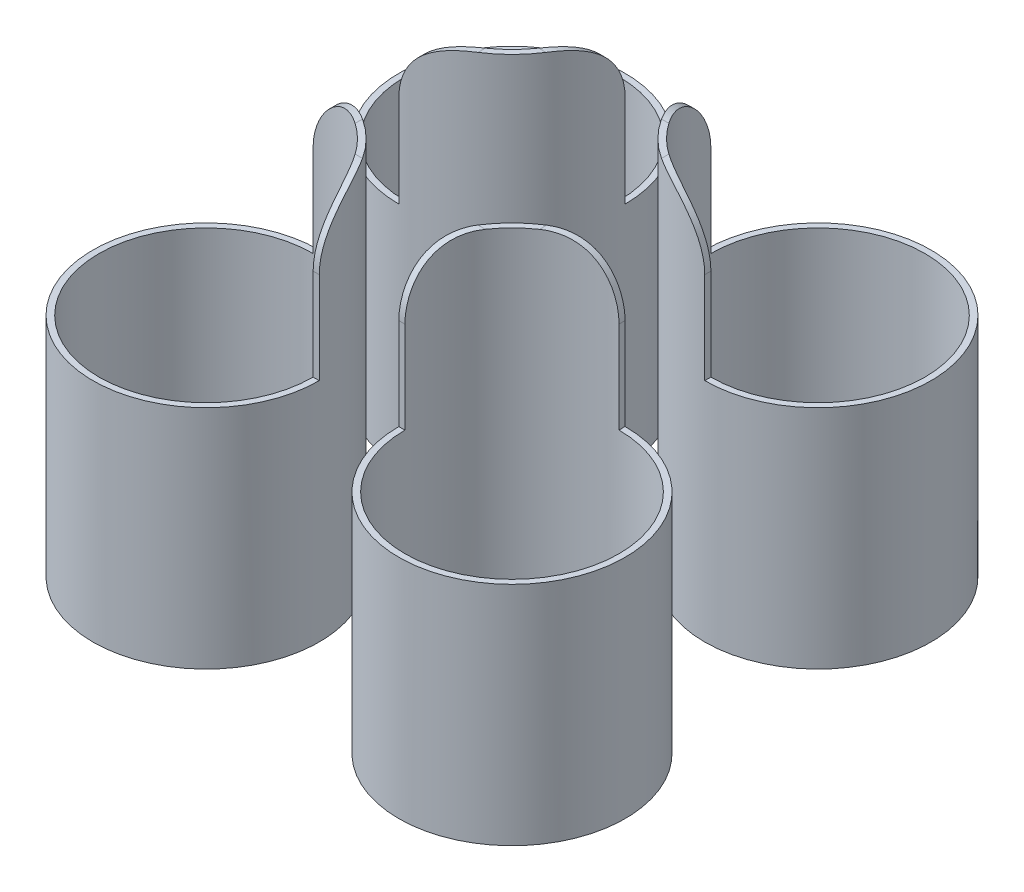
from build123d import *

# Parameters (mm, degrees)
SKETCH1_R             = 18.5
SKETCH1_R_2           = 4.4
BOSS_EXTRUDE1_DEPTH   = 2
BOSS_EXTRUDE1_2_DEPTH = 2
BOSS_EXTRUDE1_3_DEPTH = 2
BOSS_EXTRUDE1_4_DEPTH = 2
SKETCH2_R             = 18.5
SKETCH2_R_2           = 17.5
BOSS_EXTRUDE2_DEPTH   = 35
BOSS_EXTRUDE3_DEPTH   = 25
FILLET1_R             = 10
FILLET2_R             = 10
FILLET3_R             = 10
FILLET4_R             = 10


with BuildPart() as part:
    # Sketch1 → Boss-Extrude1 (new body)
    with BuildSketch(Plane(origin=(0, 0, 0), x_dir=(1, 0, 0), z_dir=(0, 1, 0))):
        with Locations(Location((0, 0, 0), (0, 0, 270))):
            Circle(SKETCH1_R)
        with Locations(Location((-7, -7, 0), (0, 0, 270))):
            Circle(SKETCH1_R_2, mode=Mode.SUBTRACT)
        with Locations(Location((-7, 7, 0), (0, 0, 270))):
            Circle(SKETCH1_R_2, mode=Mode.SUBTRACT)
        with Locations(Location((7, 7, 0), (0, 0, 270))):
            Circle(SKETCH1_R_2, mode=Mode.SUBTRACT)
        with Locations(Location((7, -7, 0), (0, 0, 270))):
            Circle(SKETCH1_R_2, mode=Mode.SUBTRACT)
    extrude(amount=BOSS_EXTRUDE1_DEPTH)



with BuildPart() as body_2:
    # Sketch1 → Boss-Extrude1 2 (new body)
    with BuildSketch(Plane(origin=(0, 0, 0), x_dir=(1, 0, 0), z_dir=(0, 1, 0))):
        with Locations(Location((0, 50, 0), (0, 0, 270))):
            Circle(SKETCH1_R)
        with Locations(Location((-7, 43, 0), (0, 0, 270))):
            Circle(SKETCH1_R_2, mode=Mode.SUBTRACT)
        with Locations(Location((-7, 57, 0), (0, 0, 270))):
            Circle(SKETCH1_R_2, mode=Mode.SUBTRACT)
        with Locations(Location((7, 43, 0), (0, 0, 270))):
            Circle(SKETCH1_R_2, mode=Mode.SUBTRACT)
        with Locations(Location((7, 57, 0), (0, 0, 270))):
            Circle(SKETCH1_R_2, mode=Mode.SUBTRACT)
    extrude(amount=BOSS_EXTRUDE1_2_DEPTH)


with BuildPart() as body_3:
    # Sketch1 → Boss-Extrude1 3 (new body)
    with BuildSketch(Plane(origin=(0, 0, 0), x_dir=(1, 0, 0), z_dir=(0, 1, 0))):
        with Locations(Location((50, 0, 0), (0, 0, 270))):
            Circle(SKETCH1_R)
        with Locations(Location((43, -7, 0), (0, 0, 270))):
            Circle(SKETCH1_R_2, mode=Mode.SUBTRACT)
        with Locations(Location((43, 7, 0), (0, 0, 270))):
            Circle(SKETCH1_R_2, mode=Mode.SUBTRACT)
        with Locations(Location((57, -7, 0), (0, 0, 270))):
            Circle(SKETCH1_R_2, mode=Mode.SUBTRACT)
        with Locations(Location((57, 7, 0), (0, 0, 270))):
            Circle(SKETCH1_R_2, mode=Mode.SUBTRACT)
    extrude(amount=BOSS_EXTRUDE1_3_DEPTH)


with BuildPart() as body_4:
    # Sketch1 → Boss-Extrude1 4 (new body)
    with BuildSketch(Plane(origin=(0, 0, 0), x_dir=(1, 0, 0), z_dir=(0, 1, 0))):
        with Locations(Location((50, 50, 0), (0, 0, 270))):
            Circle(SKETCH1_R)
        with Locations(Location((43, 43, 0), (0, 0, 270))):
            Circle(SKETCH1_R_2, mode=Mode.SUBTRACT)
        with Locations(Location((57, 43, 0), (0, 0, 270))):
            Circle(SKETCH1_R_2, mode=Mode.SUBTRACT)
        with Locations(Location((43, 57, 0), (0, 0, 270))):
            Circle(SKETCH1_R_2, mode=Mode.SUBTRACT)
        with Locations(Location((57, 57, 0), (0, 0, 270))):
            Circle(SKETCH1_R_2, mode=Mode.SUBTRACT)
    extrude(amount=BOSS_EXTRUDE1_4_DEPTH)


with BuildPart() as part_1:
    add(part.part)

    add(body_2.part)  # Boss-Extrude2 merges body 2

    add(body_3.part)  # Boss-Extrude2 merges body 3

    add(body_4.part)  # Boss-Extrude2 merges body 4
    # Sketch2 → Boss-Extrude2 (add)
    # profile 1 of 4: a face of its own
    with BuildSketch(Plane(origin=(0, 2, 0), x_dir=(1, 0, 0), z_dir=(0, 1, 0))):
        with Locations(Location((0, 0, 0), (0, 0, 90))):
            Circle(SKETCH2_R)
        with Locations(Location((0, 0, 0), (0, 0, 90))):
            Circle(SKETCH2_R_2, mode=Mode.SUBTRACT)
    # profile 2 of 4: a face of its own
    with BuildSketch(Plane(origin=(0, 2, 0), x_dir=(1, 0, 0), z_dir=(0, 1, 0))):
        with Locations(Location((50, 0, 0), (0, 0, 90))):
            Circle(SKETCH2_R)
        with Locations(Location((50, 0, 0), (0, 0, 90))):
            Circle(SKETCH2_R_2, mode=Mode.SUBTRACT)
    # profile 3 of 4: a face of its own
    with BuildSketch(Plane(origin=(0, 2, 0), x_dir=(1, 0, 0), z_dir=(0, 1, 0))):
        with Locations(Location((50, 50, 0), (0, 0, 90))):
            Circle(SKETCH2_R)
        with Locations(Location((50, 50, 0), (0, 0, 90))):
            Circle(SKETCH2_R_2, mode=Mode.SUBTRACT)
    # profile 4 of 4: a face of its own
    with BuildSketch(Plane(origin=(0, 2, 0), x_dir=(1, 0, 0), z_dir=(0, 1, 0))):
        with Locations(Location((0, 50, 0), (0, 0, 90))):
            Circle(SKETCH2_R)
        with Locations(Location((0, 50, 0), (0, 0, 90))):
            Circle(SKETCH2_R_2, mode=Mode.SUBTRACT)
    extrude(amount=BOSS_EXTRUDE2_DEPTH)

    # Sketch3 → Boss-Extrude3 (add)
    with BuildSketch(Plane(origin=(0, 37, 0), x_dir=(1, 0, 0), z_dir=(0, 1, 0))):
        with BuildLine():
            ThreePointArc((31.5, 50), (36.918524548, 36.918524548), (50, 31.5))
            Line((50, 31.5), (50, 32.5))
            ThreePointArc((50, 32.5), (37.625631329, 37.625631329), (32.5, 50))
            Line((32.5, 50), (31.5, 50))
        make_face()
        with BuildLine():
            ThreePointArc((0, 31.5), (13.081475452, 36.918524548), (18.5, 50))
            Line((18.5, 50), (17.5, 50))
            ThreePointArc((17.5, 50), (12.374368671, 37.625631329), (0, 32.5))
            Line((0, 32.5), (0, 31.5))
        make_face()
        with BuildLine():
            ThreePointArc((18.5, 0), (13.081475452, 13.081475452), (0, 18.5))
            Line((0, 18.5), (0, 17.5))
            ThreePointArc((0, 17.5), (12.374368671, 12.374368671), (17.5, 0))
            Line((17.5, 0), (18.5, 0))
        make_face()
        with BuildLine():
            Line((50, 17.5), (49.967973628, 18.499972279))
            ThreePointArc((49.967973628, 18.499972279), (36.907206412, 13.070147515), (31.5, 0))
            Line((31.5, 0), (32.5, 0))
            ThreePointArc((32.5, 0), (37.625631329, 12.374368671), (50, 17.5))
        make_face()
    extrude(amount=BOSS_EXTRUDE3_DEPTH)

    # Fillet1
    # the kernel refuses this fillet: 10 mm, written as the material it takes off along each edge
    with BuildSketch(Plane(origin=(50.800271171, 62, 7.487188038), x_dir=(0, -1, 0), z_dir=(-0.032010846851567645, 0, -0.9994875215248291))) as fillet1_piece_1_section:
        with BuildLine():
            CenterArc((FILLET1_R, FILLET1_R), FILLET1_R, 180, 90)
            Line((0, FILLET1_R), (-FILLET1_R * 0.02, FILLET1_R))
            Line((-FILLET1_R * 0.02, FILLET1_R), (-FILLET1_R * 0.02, -FILLET1_R * 0.02))
            Line((-FILLET1_R * 0.02, -FILLET1_R * 0.02), (FILLET1_R, -FILLET1_R * 0.02))
            Line((FILLET1_R, -FILLET1_R * 0.02), (FILLET1_R, 0))
        make_face()
    fillet1_piece_1 = extrude(amount=51.000485006, mode=Mode.PRIVATE)
    fillet1_piece_1 = fillet1_piece_1 & Plane(origin=(50, 59.758154055, 0), x_dir=(-0.001731155259173072, 0, -0.9999985015496117), z_dir=(0, -1, 0)) * Cylinder(18.5, 143, mode=Mode.PRIVATE)
    fillet1_piece_1 = fillet1_piece_1 - Plane(origin=(50, 59.758154055, 0), x_dir=(-1, 0, 0), z_dir=(0, -1, 0)) * Cylinder(17.5, 143, mode=Mode.PRIVATE)
    add(fillet1_piece_1, mode=Mode.SUBTRACT)
    with BuildSketch(Plane(origin=(6.5, 62, 0), x_dir=(0, -1, 0), z_dir=(1, 0, 0))) as fillet1_piece_2_section:
        with BuildLine():
            CenterArc((FILLET1_R, FILLET1_R), FILLET1_R, 180, 90)
            Line((0, FILLET1_R), (-FILLET1_R * 0.02, FILLET1_R))
            Line((-FILLET1_R * 0.02, FILLET1_R), (-FILLET1_R * 0.02, -FILLET1_R * 0.02))
            Line((-FILLET1_R * 0.02, -FILLET1_R * 0.02), (FILLET1_R, -FILLET1_R * 0.02))
            Line((FILLET1_R, -FILLET1_R * 0.02), (FILLET1_R, 0))
        make_face()
    fillet1_piece_2 = extrude(amount=51, mode=Mode.PRIVATE)
    fillet1_piece_2 = fillet1_piece_2 & Plane(origin=(50, 59.763635788, 0), x_dir=(-0.001731155259173072, 0, -0.9999985015496117), z_dir=(0, -1, 0)) * Cylinder(18.5, 142, mode=Mode.PRIVATE)
    fillet1_piece_2 = fillet1_piece_2 - Plane(origin=(50, 59.763635788, 0), x_dir=(-1, 0, 0), z_dir=(0, -1, 0)) * Cylinder(17.5, 142, mode=Mode.PRIVATE)
    add(fillet1_piece_2, mode=Mode.SUBTRACT)

    # Fillet2
    # the kernel refuses this fillet: 10 mm, written as the material it takes off along each edge
    with BuildSketch(Plane(origin=(57.5, 62, -50), x_dir=(0, -1, 0), z_dir=(-1, 0, 0))) as fillet2_piece_1_section:
        with BuildLine():
            CenterArc((FILLET2_R, FILLET2_R), FILLET2_R, 180, 90)
            Line((0, FILLET2_R), (-FILLET2_R * 0.02, FILLET2_R))
            Line((-FILLET2_R * 0.02, FILLET2_R), (-FILLET2_R * 0.02, -FILLET2_R * 0.02))
            Line((-FILLET2_R * 0.02, -FILLET2_R * 0.02), (FILLET2_R, -FILLET2_R * 0.02))
            Line((FILLET2_R, -FILLET2_R * 0.02), (FILLET2_R, 0))
        make_face()
    fillet2_piece_1 = extrude(amount=51, mode=Mode.PRIVATE)
    fillet2_piece_1 = fillet2_piece_1 & Plane(origin=(50, 59.763632396, -50), x_dir=(-1, 0, 0), z_dir=(0, -1, 0)) * Cylinder(18.5, 142, mode=Mode.PRIVATE)
    fillet2_piece_1 = fillet2_piece_1 - Plane(origin=(50, 59.763632396, -50), x_dir=(0, 0, 1), z_dir=(0, -1, 0)) * Cylinder(17.5, 142, mode=Mode.PRIVATE)
    add(fillet2_piece_1, mode=Mode.SUBTRACT)
    with BuildSketch(Plane(origin=(50, 62, -6.5), x_dir=(0, -1, 0), z_dir=(0, 0, -1))) as fillet2_piece_2_section:
        with BuildLine():
            CenterArc((FILLET2_R, FILLET2_R), FILLET2_R, 180, 90)
            Line((0, FILLET2_R), (-FILLET2_R * 0.02, FILLET2_R))
            Line((-FILLET2_R * 0.02, FILLET2_R), (-FILLET2_R * 0.02, -FILLET2_R * 0.02))
            Line((-FILLET2_R * 0.02, -FILLET2_R * 0.02), (FILLET2_R, -FILLET2_R * 0.02))
            Line((FILLET2_R, -FILLET2_R * 0.02), (FILLET2_R, 0))
        make_face()
    fillet2_piece_2 = extrude(amount=51, mode=Mode.PRIVATE)
    fillet2_piece_2 = fillet2_piece_2 & Plane(origin=(50, 59.763635785, -50), x_dir=(-1, 0, 0), z_dir=(0, -1, 0)) * Cylinder(18.5, 142, mode=Mode.PRIVATE)
    fillet2_piece_2 = fillet2_piece_2 - Plane(origin=(50, 59.763635785, -50), x_dir=(0, 0, 1), z_dir=(0, -1, 0)) * Cylinder(17.5, 142, mode=Mode.PRIVATE)
    add(fillet2_piece_2, mode=Mode.SUBTRACT)

    # Fillet3
    # the kernel refuses this fillet: 10 mm, written as the material it takes off along each edge
    with BuildSketch(Plane(origin=(0, 62, -57.5), x_dir=(0, -1, 0), z_dir=(0, 0, 1))) as fillet3_piece_1_section:
        with BuildLine():
            CenterArc((FILLET3_R, FILLET3_R), FILLET3_R, 180, 90)
            Line((0, FILLET3_R), (-FILLET3_R * 0.02, FILLET3_R))
            Line((-FILLET3_R * 0.02, FILLET3_R), (-FILLET3_R * 0.02, -FILLET3_R * 0.02))
            Line((-FILLET3_R * 0.02, -FILLET3_R * 0.02), (FILLET3_R, -FILLET3_R * 0.02))
            Line((FILLET3_R, -FILLET3_R * 0.02), (FILLET3_R, 0))
        make_face()
    fillet3_piece_1 = extrude(amount=51, mode=Mode.PRIVATE)
    fillet3_piece_1 = fillet3_piece_1 & Plane(origin=(0, 59.763632401, -50), x_dir=(0, 0, 1), z_dir=(0, -1, 0)) * Cylinder(18.5, 142, mode=Mode.PRIVATE)
    fillet3_piece_1 = fillet3_piece_1 - Plane(origin=(0, 59.763632401, -50), x_dir=(1, 0, 0), z_dir=(0, -1, 0)) * Cylinder(17.5, 142, mode=Mode.PRIVATE)
    add(fillet3_piece_1, mode=Mode.SUBTRACT)
    with BuildSketch(Plane(origin=(43.5, 62, -50), x_dir=(0, -1, 0), z_dir=(-1, 0, 0))) as fillet3_piece_2_section:
        with BuildLine():
            CenterArc((FILLET3_R, FILLET3_R), FILLET3_R, 180, 90)
            Line((0, FILLET3_R), (-FILLET3_R * 0.02, FILLET3_R))
            Line((-FILLET3_R * 0.02, FILLET3_R), (-FILLET3_R * 0.02, -FILLET3_R * 0.02))
            Line((-FILLET3_R * 0.02, -FILLET3_R * 0.02), (FILLET3_R, -FILLET3_R * 0.02))
            Line((FILLET3_R, -FILLET3_R * 0.02), (FILLET3_R, 0))
        make_face()
    fillet3_piece_2 = extrude(amount=51, mode=Mode.PRIVATE)
    fillet3_piece_2 = fillet3_piece_2 & Plane(origin=(0, 59.763635788, -50), x_dir=(0, 0, 1), z_dir=(0, -1, 0)) * Cylinder(18.5, 142, mode=Mode.PRIVATE)
    fillet3_piece_2 = fillet3_piece_2 - Plane(origin=(0, 59.763635788, -50), x_dir=(1, 0, 0), z_dir=(0, -1, 0)) * Cylinder(17.5, 142, mode=Mode.PRIVATE)
    add(fillet3_piece_2, mode=Mode.SUBTRACT)

    # Fillet4
    # the kernel refuses this fillet: 10 mm, written as the material it takes off along each edge
    with BuildSketch(Plane(origin=(-7.5, 62, 0), x_dir=(0, -1, 0), z_dir=(1, 0, 0)), Plane(origin=(0, 62, -43.5), x_dir=(0, -1, 0), z_dir=(0, 0, 1))) as fillet4_piece_1:
        with BuildLine():
            CenterArc((FILLET4_R, FILLET4_R), FILLET4_R, 180, 90)
            Line((0, FILLET4_R), (0, 0))
            Line((0, 0), (FILLET4_R, 0))
        make_face()
    extrude(amount=51, mode=Mode.SUBTRACT)


solid = part_1.part
